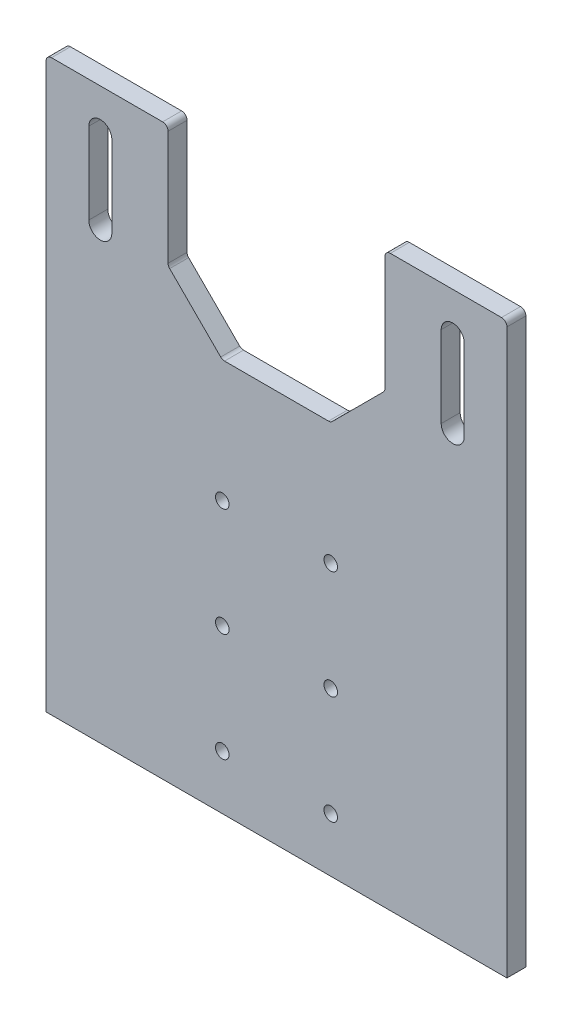
from build123d import *

# Parameters (mm, degrees)
SKETCH1_R           = 2.5
BOSS_EXTRUDE1_DEPTH = 12
CUT_EXTRUDE1_DEPTH  = 5
FILLET1_R           = 2
SKETCH4_R           = 1.5
CUT_EXTRUDE2_DEPTH  = 5


with BuildPart() as part:
    # Sketch1 → Boss-Extrude1 (new body)
    with BuildSketch(Plane.XY):
        Polygon((0, 210), (45, 210), (45, 165), (65, 145), (105, 145), (125, 165), (125, 210), (170, 210), (170, 0), (0, 0), align=None)
        with Locations((65, 20)):
            Circle(SKETCH1_R, mode=Mode.SUBTRACT)
        with Locations((65, 60)):
            Circle(SKETCH1_R, mode=Mode.SUBTRACT)
        with Locations((65, 100)):
            Circle(SKETCH1_R, mode=Mode.SUBTRACT)
        with Locations((105, 100)):
            Circle(SKETCH1_R, mode=Mode.SUBTRACT)
        with Locations((105, 60)):
            Circle(SKETCH1_R, mode=Mode.SUBTRACT)
        with Locations((105, 20)):
            Circle(SKETCH1_R, mode=Mode.SUBTRACT)
        with BuildLine():
            Line((154.25, 195), (154.25, 165))
            ThreePointArc((154.25, 165), (150, 160.75), (145.75, 165))
            Line((145.75, 165), (145.75, 195))
            ThreePointArc((145.75, 195), (150, 199.25), (154.25, 195))
        make_face(mode=Mode.SUBTRACT)
        with BuildLine():
            Line((15.75, 195), (15.75, 165))
            ThreePointArc((15.75, 165), (20, 160.75), (24.25, 165))
            Line((24.25, 165), (24.25, 195))
            ThreePointArc((24.25, 195), (20, 199.25), (15.75, 195))
        make_face(mode=Mode.SUBTRACT)
    extrude(amount=BOSS_EXTRUDE1_DEPTH)

    # Sketch3 → Cut-Extrude1 (cut)
    with BuildSketch(Plane(origin=(0, 0, 0), x_dir=(-1, 0, 0), z_dir=(0, 0, -1))):
        Polygon((0, 0), (-55, 0), (-55, 115), (-115, 115), (-115, 0), (-170, 0), (-170, 210), (-115, 210), (-55, 210), (0, 210), align=None)
    extrude(amount=-CUT_EXTRUDE1_DEPTH, mode=Mode.SUBTRACT)

    # Fillet1
    fillet1_edges = [part.edges().sort_by_distance(p)[0] for p in [
        (170, 210, 8.5),
        (125, 210, 8.5),
        (125, 165, 8.5),
        (105, 145, 8.5),
        (65, 145, 8.5),
        (45, 165, 8.5),
        (45, 210, 8.5),
        (0, 210, 8.5),
    ]]
    fillet(fillet1_edges, radius=FILLET1_R)

    # Sketch4 → Cut-Extrude2 (cut)
    with BuildSketch(Plane.XZ):
        with Locations((85, 6)):
            Circle(SKETCH4_R)
        with Locations((105, 6)):
            Circle(SKETCH4_R)
        with Locations((155, 8.5)):
            Circle(SKETCH4_R)
        with Locations((125, 8.5)):
            Circle(SKETCH4_R)
        with Locations((15, 8.5)):
            Circle(SKETCH4_R)
        with Locations((45, 8.5)):
            Circle(SKETCH4_R)
        with Locations((65, 6)):
            Circle(SKETCH4_R)
    extrude(amount=-CUT_EXTRUDE2_DEPTH, mode=Mode.SUBTRACT)


solid = part.part
